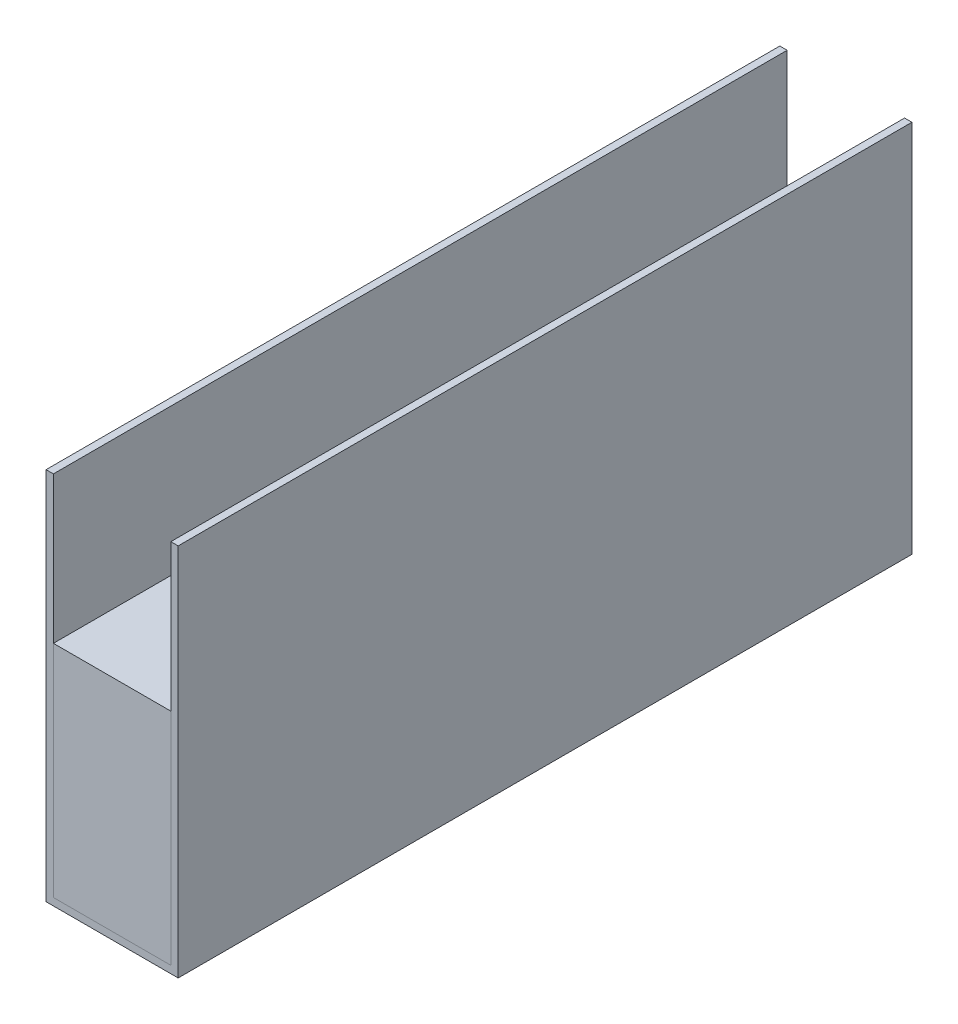
from build123d import *

# Parameters (mm, degrees)
BOSS_EXTRUDE1_DEPTH = 500
SKETCH1_4_W         = 80
SKETCH1_4_H         = 150
BOSS_EXTRUDE3_DEPTH = 500


with BuildPart() as part:
    # Sketch1 → Boss-Extrude1 (new body)
    with BuildSketch(Plane.XY):
        Polygon((45, 125), (45, -130), (-45, -130), (-45, 125), (-40, 125), (-40, -125), (40, -125), (40, 125), align=None)
    extrude(amount=BOSS_EXTRUDE1_DEPTH)


with BuildPart() as body_2:
    # Sketch1<4> → Boss-Extrude3 (new body)
    with BuildSketch(Plane.XY):
        with Locations((0, -50)):
            Rectangle(SKETCH1_4_W, SKETCH1_4_H)
    extrude(amount=BOSS_EXTRUDE3_DEPTH)


solid = Compound([part.part, body_2.part])
